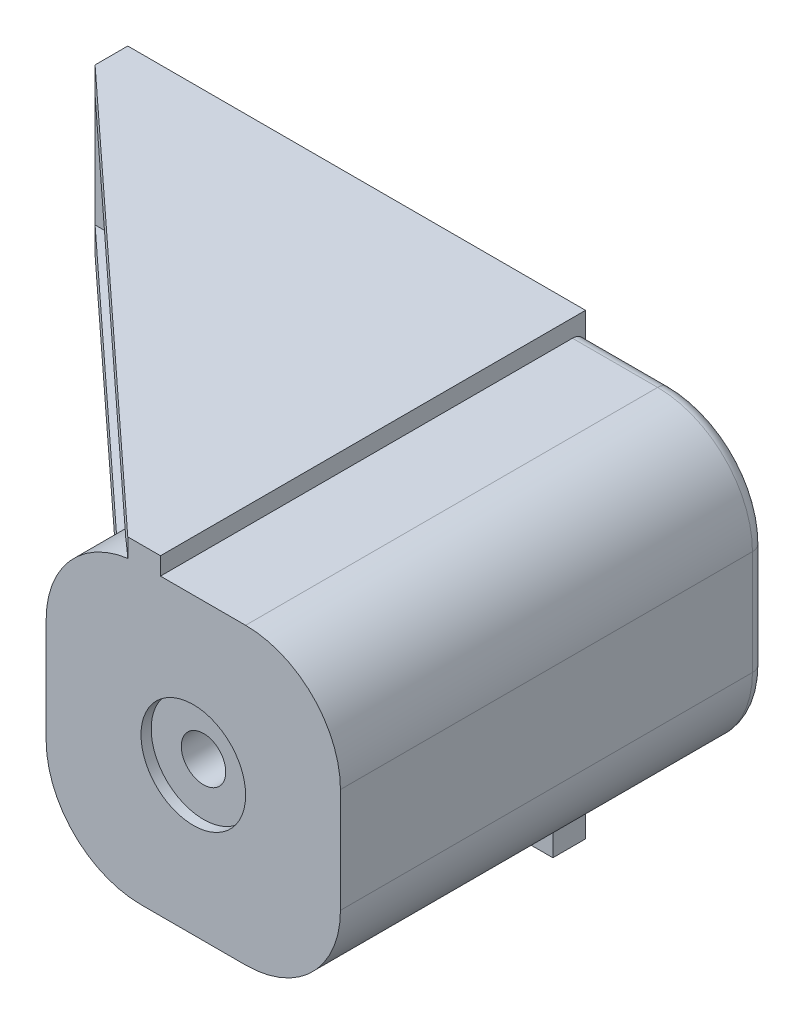
from build123d import *

# Parameters (mm, degrees)
BOSS_EXTRUDE1_DEPTH = 65
FILLET1_R           = 2
BOSS_EXTRUDE2_START = -10
BOSS_EXTRUDE2_DEPTH = 10
SKETCH3_R           = 3.4
CUT_EXTRUDE1_DEPTH  = 73.370574131
SKETCH4_R           = 8
CUT_EXTRUDE2_DEPTH  = 1.56
BOSS_EXTRUDE3_DEPTH = 5
BOSS_EXTRUDE4_DEPTH = 4
BOSS_EXTRUDE5_DEPTH = 4


with BuildPart() as part:
    # Sketch1 → Boss-Extrude1 (new body)
    with BuildSketch(Plane.XY):
        with BuildLine():
            Line((8, 22.5), (-8, 22.5))
            ThreePointArc((-8, 22.5), (-18.253048327, 18.253048327), (-22.5, 8))
            Line((-22.5, 8), (-22.5, -8))
            ThreePointArc((-22.5, -8), (-18.253048327, -18.253048327), (-8, -22.5))
            Line((-8, -22.5), (8, -22.5))
            ThreePointArc((8, -22.5), (18.253048327, -18.253048327), (22.5, -8))
            Line((22.5, -8), (22.5, 8))
            ThreePointArc((22.5, 8), (18.253048327, 18.253048327), (8, 22.5))
        make_face()
        with BuildLine():
            ThreePointArc((-18, 8), (-15.071067812, 15.071067812), (-8, 18))
            Line((-8, 18), (8, 18))
            ThreePointArc((8, 18), (15.071067812, 15.071067812), (18, 8))
            Line((18, 8), (18, -8))
            ThreePointArc((18, -8), (15.071067812, -15.071067812), (8, -18))
            Line((8, -18), (-8, -18))
            ThreePointArc((-8, -18), (-15.071067812, -15.071067812), (-18, -8))
            Line((-18, -8), (-18, 8))
        make_face(mode=Mode.SUBTRACT)
    extrude(amount=BOSS_EXTRUDE1_DEPTH)

    # Fillet1
    fillet1_edges = [part.edges().sort_by_distance(p)[0] for p in [
        (-22.5, 0, 0),
        (-18.253048327, -18.253048327, 0),
        (0, -22.5, 0),
        (18.253048327, -18.253048327, 0),
        (22.5, 0, 0),
        (18.253048327, 18.253048327, 0),
        (0, 22.5, 0),
        (-18.253048327, 18.253048327, 0),
        (15.071067812, -15.071067812, 0),
        (0, -18, 0),
        (-15.071067812, -15.071067812, 0),
        (-18, 0, 0),
        (-15.071067812, 15.071067812, 0),
        (0, 18, 0),
        (15.071067812, 15.071067812, 0),
        (18, 0, 0),
    ]]
    fillet(fillet1_edges, radius=FILLET1_R)

    # Sketch2 → Boss-Extrude2 (add)
    with BuildSketch(Plane.XY.offset(65).offset(BOSS_EXTRUDE2_START)):
        with BuildLine():
            Line((8, -22.5), (-8, -22.5))
            ThreePointArc((-8, -22.5), (-18.253048327, -18.253048327), (-22.5, -8))
            Line((-22.5, -8), (-22.5, 8))
            ThreePointArc((-22.5, 8), (-18.253048327, 18.253048327), (-8, 22.5))
            Line((-8, 22.5), (8, 22.5))
            ThreePointArc((8, 22.5), (18.253048327, 18.253048327), (22.5, 8))
            Line((22.5, 8), (22.5, -8))
            ThreePointArc((22.5, -8), (18.253048327, -18.253048327), (8, -22.5))
        make_face()
    extrude(amount=BOSS_EXTRUDE2_DEPTH)

    # Sketch3 → Cut-Extrude1 (cut, through all)
    with BuildSketch(Plane.XY.offset(65)):
        Circle(SKETCH3_R)
    extrude(amount=-CUT_EXTRUDE1_DEPTH, mode=Mode.SUBTRACT)

    # Sketch4 → Cut-Extrude2 (cut)
    with BuildSketch(Plane.XY.offset(65)):
        Circle(SKETCH4_R)
    extrude(amount=-CUT_EXTRUDE2_DEPTH, mode=Mode.SUBTRACT)

    # Sketch5 → Boss-Extrude3 (add)
    with BuildSketch(Plane.XY):
        with BuildLine():
            Line((-75.02, 25.2), (-5.02, 25.2))
            Line((-5.02, 25.2), (-5.02, 20))
            Line((-5.02, 20), (-8, 20))
            ThreePointArc((-8, 20), (-16.485281374, 16.485281374), (-20, 8))
            Line((-20, 8), (-20, -8))
            ThreePointArc((-20, -8), (-16.485281374, -16.485281374), (-8, -20))
            Line((-8, -20), (-5.02, -20))
            Line((-5.02, -20), (-5.02, -44.8))
            Line((-5.02, -44.8), (-30.42, -44.8))
            Line((-30.42, -44.8), (-75.02, -0.2))
            Line((-75.02, -0.2), (-75.02, 25.2))
        make_face()
    extrude(amount=BOSS_EXTRUDE3_DEPTH)

    # Sketch6 → Boss-Extrude4 (add)
    with BuildSketch(Plane(origin=(0, 25.2, 0), x_dir=(1, 0, 0), z_dir=(0, 1, 0))):
        Polygon((-75.02, 0), (-75.02, -5), (-10.02, -65), (-5.02, -65), (-5.02, 0), align=None)
    extrude(amount=-BOSS_EXTRUDE4_DEPTH)

    # Sketch7 → Boss-Extrude5 (add)
    with BuildSketch(Plane(origin=(0, 0, 0), x_dir=(1, 0, 0), z_dir=(0, 1, 0))):
        Polygon((-75.02, -5), (-22.5, -53.48), (-22.5, -5), align=None)
    extrude(amount=BOSS_EXTRUDE5_DEPTH)


solid = part.part
